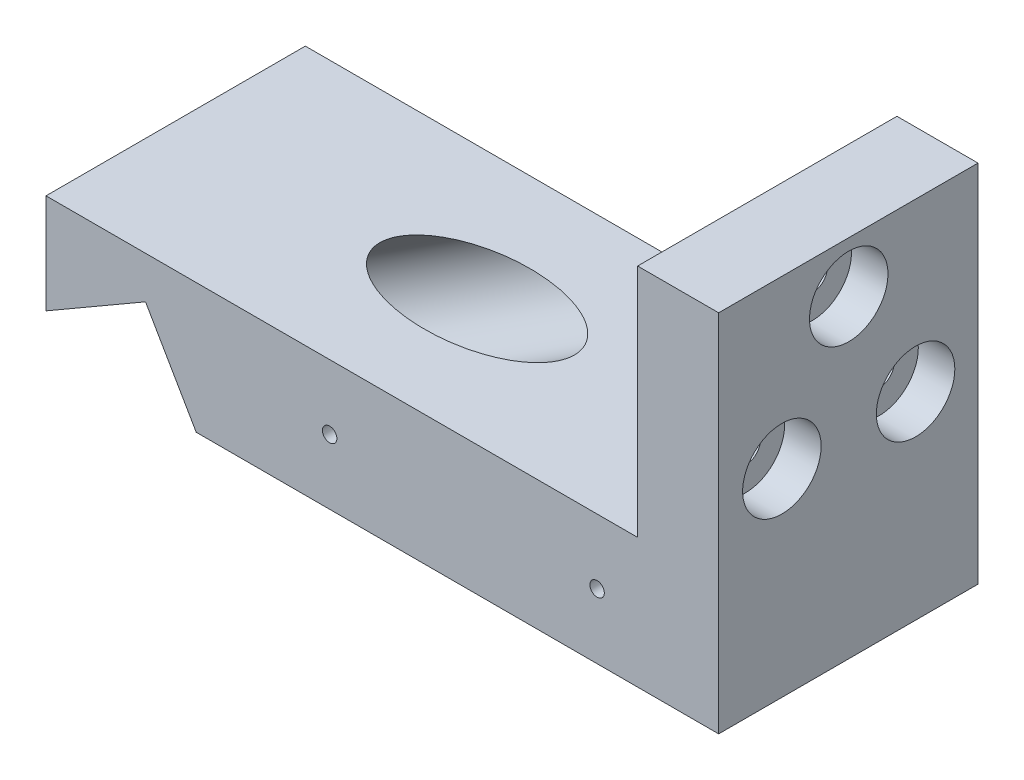
from build123d import *

# Parameters (mm, degrees)
SKETCH1_W                                      = 73
SKETCH1_H                                      = 40
BOSS_EXTRUDE1_DEPTH                            = 16
CUT_EXTRUDE1_DEPTH                             = 31
CUT_EXTRUDE2_REACH                             = 59.847
SKETCH14_R                                     = 6.5
CUT_EXTRUDE2_DIRECTION_2_REACH                 = 59.847
SKETCH15_R                                     = 1.595
CUT_EXTRUDE3_DEPTH                             = 4.32
SKETCH16_R                                     = 1.595
CUT_EXTRUDE4_DEPTH                             = 6.32
SKETCH18_R                                     = 1.595
CUT_EXTRUDE6_DEPTH                             = 6.32
SKETCH26_W                                     = 10
SKETCH26_H                                     = 40
BOSS_EXTRUDE2_DEPTH                            = 45
SKETCH27_R                                     = 1.595
CUT_EXTRUDE7_DEPTH                             = 97.509066932
SKETCH28_R                                     = 1.595
CUT_EXTRUDE10_DEPTH                            = 6.32
BOSS_EXTRUDE3_DEPTH                            = 1
SKETCH37_R                                     = 1.595
CUT_EXTRUDE14_DEPTH                            = 6.78
CUT_EXTRUDE15_START                            = -6.78
SKETCH38_R                                     = 1.595
CUT_EXTRUDE15_DEPTH                            = 6.78
SKETCH52_W                                     = 101.196897311
SKETCH52_H                                     = 58.467472524
CUT_EXTRUDE21_DEPTH                            = 9
CBORE_FOR_6_SOCKET_HEAD_CAP_SCREW1_D           = 3.7973
CBORE_FOR_6_SOCKET_HEAD_CAP_SCREW1_DEPTH       = 46.5
CBORE_FOR_6_SOCKET_HEAD_CAP_SCREW1_CBORE_D     = 9.68502
CBORE_FOR_6_SOCKET_HEAD_CAP_SCREW1_CBORE_DEPTH = 4.505198
CBORE_FOR_6_SOCKET_HEAD_CAP_SCREW1_TIP         = 1.140824014


# Read off the part's stored shape, not the designer's step: AdvancedHole3, AdvancedHole4
with BuildPart() as part:
    # Sketch1 → Boss-Extrude1 (new body)
    with BuildSketch(Plane(origin=(0, 0, 0), x_dir=(1, 0, 0), z_dir=(0, 1, 0))):
        Rectangle(SKETCH1_W, SKETCH1_H)
    extrude(amount=BOSS_EXTRUDE1_DEPTH)

    # Sketch5 → Cut-Extrude1 (cut)
    with BuildSketch(Plane(origin=(0, 0, -20), x_dir=(-1, 0, 0), z_dir=(0, 0, -1))):
        Polygon((17.965335593, 0), (24.220929062, 10.809975543), (36.5, 3.704235511), (36.5, 0), align=None)
    extrude(amount=-CUT_EXTRUDE1_DEPTH, mode=Mode.SUBTRACT)

    # Sketch14 → Cut-Extrude2 (cut, up to next)
    with BuildSketch(Plane(origin=(2.103927099, 16, -20), x_dir=(0, 0, 1), z_dir=(-0.8407935043817242, -0.5413559669842936, 0)), mode=Mode.PRIVATE) as cut_extrude2_sk1:
        with Locations(Location((15.40672826, 0.54117756, 0), (0, 0, 208.778472392))):
            Circle(SKETCH14_R)
    cut_extrude2_tool1 = extrude(cut_extrude2_sk1.sketch, amount=-CUT_EXTRUDE2_REACH, mode=Mode.PRIVATE) & part.part
    add(cut_extrude2_tool1.solids().sort_by_distance((1.810957, 16.455019, -4.593272))[0], mode=Mode.SUBTRACT)

    # Sketch14 → Cut-Extrude2 direction 2 (cut, up to next)
    with BuildSketch(Plane(origin=(2.103927099, 16, -20), x_dir=(0, 0, 1), z_dir=(-0.8407935043817242, -0.5413559669842936, 0)), mode=Mode.PRIVATE) as cut_extrude2_direction_2_sk1:
        with Locations(Location((15.40672826, 0.54117756, 0), (0, 0, 208.778472392))):
            Circle(SKETCH14_R)
    cut_extrude2_direction_2_tool1 = extrude(cut_extrude2_direction_2_sk1.sketch, amount=CUT_EXTRUDE2_DIRECTION_2_REACH, mode=Mode.PRIVATE) & part.part
    add(cut_extrude2_direction_2_tool1.solids().sort_by_distance((1.810957, 16.455019, -4.593272))[0], mode=Mode.SUBTRACT)

    # Sketch15 → Cut-Extrude3 (cut)
    with BuildSketch(Plane.ZY.offset(36.5)):
        with Locations((-14.800300311, 10.899842323)):
            Circle(SKETCH15_R)
        with Locations((5.199699689, 10.899842323)):
            Circle(SKETCH15_R)
    extrude(amount=-CUT_EXTRUDE3_DEPTH, mode=Mode.SUBTRACT)

    # Sketch16 → Cut-Extrude4 (cut)
    with BuildSketch(Plane(origin=(-13.45840239, -7.788203938, 0), x_dir=(0, 0, 1), z_dir=(-0.8655239452556988, -0.5008675475502585, 0))):
        with Locations(Location((-15.050029961, 13.487770019, 0), (0, 0, 270))):
            Circle(SKETCH16_R)
        with Locations(Location((4.949970039, 13.487770019, 0), (0, 0, 270))):
            Circle(SKETCH16_R)
    extrude(amount=-CUT_EXTRUDE4_DEPTH, mode=Mode.SUBTRACT)

    # Sketch18 → Cut-Extrude6 (cut)
    with BuildSketch(Plane.XY.offset(20)):
        with Locations((19, 8)):
            Circle(SKETCH18_R)
        with Locations((-19, 8)):
            Circle(SKETCH18_R)
    extrude(amount=-CUT_EXTRUDE6_DEPTH, mode=Mode.SUBTRACT)

    # Sketch26 → Boss-Extrude2 (add)
    with BuildSketch(Plane.XZ):
        with Locations((41.5, 0)):
            Rectangle(SKETCH26_W, SKETCH26_H)
    extrude(amount=-BOSS_EXTRUDE2_DEPTH)

    # Sketch27 → Cut-Extrude7 (cut, through all)
    with BuildSketch(Plane(origin=(46.5, 0, 0), x_dir=(0, 0, -1), z_dir=(1, 0, 0))):
        with Locations((5.05, 38.725)):
            Circle(SKETCH27_R)
        with Locations((13.298891971, 24.4375)):
            Circle(SKETCH27_R)
        with Locations((-3.198891971, 24.4375)):
            Circle(SKETCH27_R)
    extrude(amount=-CUT_EXTRUDE7_DEPTH, mode=Mode.SUBTRACT)

    # Sketch28 → Cut-Extrude10 (cut)
    with BuildSketch(Plane.XY.offset(20)):
        with Locations((41.5, 22.5)):
            Circle(SKETCH28_R)
    extrude(amount=-CUT_EXTRUDE10_DEPTH, mode=Mode.SUBTRACT)

    # Sketch33 → Boss-Extrude3 (add)
    with BuildSketch(Plane(origin=(0, 0, -20), x_dir=(-1, 0, 0), z_dir=(0, 0, -1))):
        Polygon((-46.5, 45), (-36.5, 45), (-36.5, 16), (36.5, 16), (36.5, 3.704235511), (24.220929062, 10.809975543), (17.965335593, 0), (-46.5, 0), align=None)
    extrude(amount=BOSS_EXTRUDE3_DEPTH)

    # Sketch37 → Cut-Extrude14 (cut)
    with BuildSketch(Plane.ZY.offset(36.5)):
        with Locations((15.5, 7.999173791)):
            Circle(SKETCH37_R)
    extrude(amount=-CUT_EXTRUDE14_DEPTH, mode=Mode.SUBTRACT)

    # Sketch38 → Cut-Extrude15 (cut)
    with BuildSketch(Plane(origin=(46.5, 0, 0), x_dir=(0, 0, -1), z_dir=(1, 0, 0)).offset(CUT_EXTRUDE15_START)):
        with Locations(Location((-15.5, 7.999173791, 0), (0, 0, 180))):
            Circle(SKETCH38_R)
    extrude(amount=CUT_EXTRUDE15_DEPTH, mode=Mode.SUBTRACT)

    # Sketch52 → Cut-Extrude21 (cut)
    with BuildSketch(Plane(origin=(0, 0, 11), x_dir=(-1, 0, 0), z_dir=(0, 0, -1))):
        with Locations((-4.130814665, 20.01964795)):
            Rectangle(SKETCH52_W, SKETCH52_H)
    extrude(amount=-CUT_EXTRUDE21_DEPTH, mode=Mode.SUBTRACT)

    # CBORE for #6 Socket Head Cap Screw1
    with Locations(Plane(origin=(46.5, 0, 0), x_dir=(0, 0, -1), z_dir=(1, 0, 0))):
        with Locations((5.05, 38.725), (13.298891971, 24.4375), (-3.198891971, 24.4375)):
            CounterBoreHole(CBORE_FOR_6_SOCKET_HEAD_CAP_SCREW1_D / 2, CBORE_FOR_6_SOCKET_HEAD_CAP_SCREW1_CBORE_D / 2, CBORE_FOR_6_SOCKET_HEAD_CAP_SCREW1_CBORE_DEPTH, depth=CBORE_FOR_6_SOCKET_HEAD_CAP_SCREW1_DEPTH)
            with Locations((0, 0, -(CBORE_FOR_6_SOCKET_HEAD_CAP_SCREW1_DEPTH + CBORE_FOR_6_SOCKET_HEAD_CAP_SCREW1_TIP / 2))):  # 118° drill point
                Cone(0, CBORE_FOR_6_SOCKET_HEAD_CAP_SCREW1_D / 2, CBORE_FOR_6_SOCKET_HEAD_CAP_SCREW1_TIP, mode=Mode.SUBTRACT)

    # AdvancedHole3 outline → AdvancedHole3 (revolve, cut)
    with BuildSketch(Plane(origin=(-1.5, 8, 0), x_dir=(1, 0, 0), z_dir=(0, -1, 0))):
        Polygon((0.889, -21), (0.889, -17.000000126), (0, -16.465835036), (0, -21), align=None)
    revolve(axis=Axis((-1.5, 8, 0), (0, 0, 1)), mode=Mode.SUBTRACT)

    # AdvancedHole3 2 outline → AdvancedHole3 2 (revolve, cut)
    with BuildSketch(Plane(origin=(31.5, 8, 0), x_dir=(1, 0, 0), z_dir=(0, -1, 0))):
        Polygon((0.889, -21), (0.889, -17.000000126), (0, -16.465835036), (0, -21), align=None)
    revolve(axis=Axis((31.5, 8, 0), (0, 0, 1)), mode=Mode.SUBTRACT)

    # AdvancedHole4 outline → AdvancedHole4 (revolve, cut)
    with BuildSketch(Plane(origin=(-1.5, 8, 0), x_dir=(1, 0, 0), z_dir=(0, -1, 0))):
        Polygon((0, 6.465835036), (0.889, 7.000000126), (0.889, 11), (0, 11), align=None)
    revolve(axis=Axis((-1.5, 8, 0), (0, 0, 1)), mode=Mode.SUBTRACT)

    # AdvancedHole4 2 outline → AdvancedHole4 2 (revolve, cut)
    with BuildSketch(Plane(origin=(31.5, 8, 0), x_dir=(1, 0, 0), z_dir=(0, -1, 0))):
        Polygon((0, 6.465835036), (0.889, 7.000000126), (0.889, 11), (0, 11), align=None)
    revolve(axis=Axis((31.5, 8, 0), (0, 0, 1)), mode=Mode.SUBTRACT)


solid = part.part
